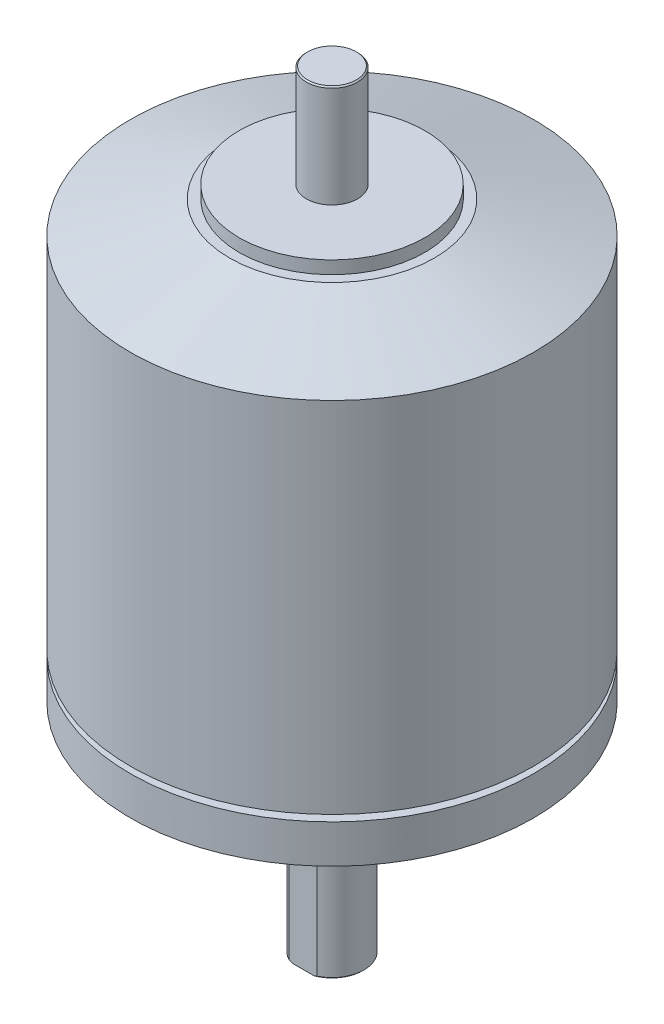
from build123d import *

# Parameters (mm, degrees)
SKETCH2_R           = 14.5
BOSS_EXTRUDE1_DEPTH = 2
SKETCH3_R           = 4
BOSS_EXTRUDE2_DEPTH = 16
SKETCH4_R           = 5
BOSS_EXTRUDE3_DEPTH = 30
CUT_EXTRUDE1_START  = -24
CUT_EXTRUDE1_DEPTH  = 24
SKETCH15_R          = 2
CUT_EXTRUDE3_DEPTH  = 10
CUT_EXTRUDE4_DEPTH  = 10
CHAMFER1_SIZE       = 0.2


with BuildPart() as part:
    # Sketch1 → Revolve1 (revolve)
    with BuildSketch(Plane.XY):
        Polygon((16, 72.000000001), (0, 72.000000001), (0, 0), (24, 0), (31.5, 4), (31.5, 10), (15, 10), (15, 11), (31.5, 11), (31.5, 67), align=None)
    revolve(axis=Axis((0, 72.000000001, 0), (0, -1, 0)))

    # Sketch2 → Boss-Extrude1 (add)
    with BuildSketch(Plane(origin=(0, 72.000000001, 0), x_dir=(-1, 0, 0), z_dir=(0, 1, 0))):
        Circle(SKETCH2_R)
    extrude(amount=BOSS_EXTRUDE1_DEPTH)

    # Sketch3 → Boss-Extrude2 (add)
    with BuildSketch(Plane(origin=(0, 74.000000001, 0), x_dir=(-1, 0, 0), z_dir=(0, 1, 0))):
        Circle(SKETCH3_R)
    extrude(amount=BOSS_EXTRUDE2_DEPTH)

    # Sketch4 → Boss-Extrude3 (add)
    with BuildSketch(Plane.XZ):
        Circle(SKETCH4_R)
    extrude(amount=BOSS_EXTRUDE3_DEPTH)

    # Sketch5 → Cut-Extrude1 (cut)
    with BuildSketch(Plane.XZ.offset(30).offset(CUT_EXTRUDE1_START)):
        with BuildLine():
            Line((-2.179449472, 4.5), (2.179449472, 4.5))
            ThreePointArc((2.179449472, 4.5), (0, 5), (-2.179449472, 4.5))
        make_face()
    extrude(amount=CUT_EXTRUDE1_DEPTH, mode=Mode.SUBTRACT)

    # Sketch15 → Cut-Extrude3 (cut)
    with BuildSketch(Plane.XZ):
        with Locations((-15.556349186, 15.556349186)):
            Circle(SKETCH15_R)
        with Locations((-10.606601718, 10.606601718)):
            Circle(SKETCH15_R)
        with Locations((15.556349186, 15.556349186)):
            Circle(SKETCH15_R)
        with Locations((10.606601718, 10.606601718)):
            Circle(SKETCH15_R)
        with Locations((15.556349186, -15.556349186)):
            Circle(SKETCH15_R)
        with Locations((10.606601718, -10.606601718)):
            Circle(SKETCH15_R)
        with Locations((-15.556349186, -15.556349186)):
            Circle(SKETCH15_R)
        with Locations((-10.606601718, -10.606601718)):
            Circle(SKETCH15_R)
    extrude(amount=-CUT_EXTRUDE3_DEPTH, mode=Mode.SUBTRACT)

    # Sketch6 → Cut-Extrude4 (cut)
    with BuildSketch(Plane(origin=(-3.2, 0, 0), x_dir=(0, 0, -1), z_dir=(1, 0, 0))):
        with BuildLine():
            Line((1.5, -24.5), (1.5, -11.5))
            ThreePointArc((1.5, -11.5), (0, -10), (-1.5, -11.5))
            Line((-1.5, -11.5), (-1.5, -24.5))
            ThreePointArc((-1.5, -24.5), (0, -26), (1.5, -24.5))
        make_face()
    extrude(amount=-CUT_EXTRUDE4_DEPTH, mode=Mode.SUBTRACT)

    # Chamfer1
    chamfer1_edges = [part.edges().sort_by_distance(p)[0] for p in [
        (4, 90.000000001, 0),
        (-2.655442773, -30, -4.236581603),
    ]]
    chamfer(chamfer1_edges, length=CHAMFER1_SIZE)


solid = part.part
